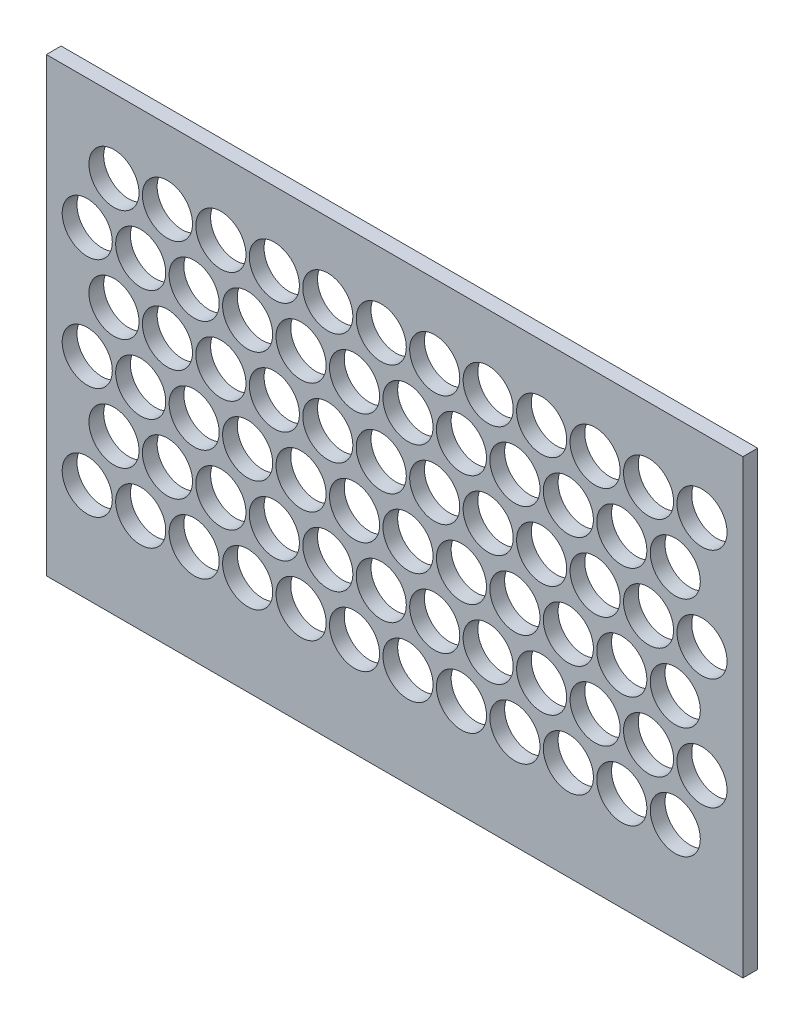
from build123d import *

# Parameters (mm, degrees)
SKETCH1_W                  = 299.700000132
SKETCH1_H                  = 194.250000104
BOSS_EXTRUDE1_DEPTH        = 6.35
CUT_EXTRUDE1_DEPTH         = 182.719853184
SKETCH4_R                  = 10.775
CUT_EXTRUDE2_DEPTH         = 182.719853184
LPATTERN1_COUNT            = 12
LPATTERN1_PITCH            = 23
LPATTERN2_COPY_1_DEPTH     = 182.719853184
LPATTERN2_COPY_2_DEPTH     = 182.719853184
LPATTERN2_COPY_3_DEPTH     = 182.719853184
LPATTERN2_COPY_4_DEPTH     = 182.719853184
LPATTERN2_COPY_5_DEPTH     = 182.719853184
LPATTERN2_COPY_6_DEPTH     = 182.719853184
LPATTERN2_COPY_7_DEPTH     = 182.719853184
LPATTERN2_COPY_8_DEPTH     = 182.719853184
LPATTERN2_COPY_9_DEPTH     = 182.719853184
LPATTERN2_COPY_10_DEPTH    = 182.719853184
LPATTERN2_COPY_11_DEPTH    = 182.719853184
LPATTERN2_COPY_12_DEPTH    = 182.719853184
LPATTERN2_COPY_13_DEPTH    = 182.719853184
LPATTERN2_COPY_14_DEPTH    = 182.719853184
LPATTERN2_COPY_15_DEPTH    = 182.719853184
LPATTERN2_COPY_16_DEPTH    = 182.719853184
LPATTERN2_COPY_17_DEPTH    = 182.719853184
LPATTERN2_COPY_18_DEPTH    = 182.719853184
LPATTERN2_COPY_19_DEPTH    = 182.719853184
LPATTERN2_COPY_20_DEPTH    = 182.719853184
LPATTERN2_COPY_21_DEPTH    = 182.719853184
LPATTERN2_COPY_22_DEPTH    = 182.719853184
LPATTERN2_COPY_23_SKETCH_R = 10.775
LPATTERN2_COPY_23_DEPTH    = 182.719853184
LPATTERN2_COPY_24_SKETCH_R = 10.775
LPATTERN2_COPY_24_DEPTH    = 182.719853184
LPATTERN2_COPY_25_SKETCH_R = 10.775
LPATTERN2_COPY_25_DEPTH    = 182.719853184
LPATTERN2_COPY_26_SKETCH_R = 10.775
LPATTERN2_COPY_26_DEPTH    = 182.719853184
LPATTERN2_COPY_27_SKETCH_R = 10.775
LPATTERN2_COPY_27_DEPTH    = 182.719853184
LPATTERN2_COPY_28_SKETCH_R = 10.775
LPATTERN2_COPY_28_DEPTH    = 182.719853184
LPATTERN2_COPY_29_SKETCH_R = 10.775
LPATTERN2_COPY_29_DEPTH    = 182.719853184
LPATTERN2_COPY_30_SKETCH_R = 10.775
LPATTERN2_COPY_30_DEPTH    = 182.719853184
LPATTERN2_COPY_31_SKETCH_R = 10.775
LPATTERN2_COPY_31_DEPTH    = 182.719853184
LPATTERN2_COPY_32_SKETCH_R = 10.775
LPATTERN2_COPY_32_DEPTH    = 182.719853184
LPATTERN2_COPY_33_SKETCH_R = 10.775
LPATTERN2_COPY_33_DEPTH    = 182.719853184
LPATTERN2_COPY_34_SKETCH_R = 10.775
LPATTERN2_COPY_34_DEPTH    = 182.719853184
LPATTERN2_COPY_35_SKETCH_R = 10.775
LPATTERN2_COPY_35_DEPTH    = 182.719853184
LPATTERN2_COPY_36_SKETCH_R = 10.775
LPATTERN2_COPY_36_DEPTH    = 182.719853184
LPATTERN2_COPY_37_SKETCH_R = 10.775
LPATTERN2_COPY_37_DEPTH    = 182.719853184
LPATTERN2_COPY_38_SKETCH_R = 10.775
LPATTERN2_COPY_38_DEPTH    = 182.719853184
LPATTERN2_COPY_39_SKETCH_R = 10.775
LPATTERN2_COPY_39_DEPTH    = 182.719853184
LPATTERN2_COPY_40_SKETCH_R = 10.775
LPATTERN2_COPY_40_DEPTH    = 182.719853184
LPATTERN2_COPY_41_SKETCH_R = 10.775
LPATTERN2_COPY_41_DEPTH    = 182.719853184
LPATTERN2_COPY_42_SKETCH_R = 10.775
LPATTERN2_COPY_42_DEPTH    = 182.719853184
LPATTERN2_COPY_43_SKETCH_R = 10.775
LPATTERN2_COPY_43_DEPTH    = 182.719853184
LPATTERN2_COPY_44_SKETCH_R = 10.775
LPATTERN2_COPY_44_DEPTH    = 182.719853184
LPATTERN2_COPY_45_DEPTH    = 182.719853184
LPATTERN2_COPY_46_DEPTH    = 182.719853184
LPATTERN2_COPY_47_SKETCH_R = 10.775
LPATTERN2_COPY_47_DEPTH    = 182.719853184
LPATTERN2_COPY_48_SKETCH_R = 10.775
LPATTERN2_COPY_48_DEPTH    = 182.719853184


with BuildPart() as part:
    # Sketch1 → Boss-Extrude1 (new body)
    with BuildSketch(Plane.XY):
        with Locations((0, -5.475000052)):
            Rectangle(SKETCH1_W, SKETCH1_H)
    extrude(amount=BOSS_EXTRUDE1_DEPTH)

    # Sketch3 → Cut-Extrude1 (cut, through all)
    with BuildSketch(Plane.XY.offset(6.35)):
        with BuildLine():
            ThreePointArc((-121.475, -60), (-132.24999993, -49.225), (-143.025, -59.999999859))
            ThreePointArc((-143.025, -59.999999859), (-139.869075617, -67.619075517), (-132.25, -70.775))
            ThreePointArc((-132.25, -70.775), (-124.630924433, -67.619075567), (-121.475, -60))
        make_face()
    cut_extrude1 = extrude(amount=-CUT_EXTRUDE1_DEPTH, mode=Mode.SUBTRACT)

    # Sketch4 → Cut-Extrude2 (cut, through all)
    with BuildSketch(Plane.XY.offset(6.35)):
        with Locations((-120.75, -36)):
            Circle(SKETCH4_R)
    cut_extrude2 = extrude(amount=-CUT_EXTRUDE2_DEPTH, mode=Mode.SUBTRACT)

    # LPattern1: Cut-Extrude1, Cut-Extrude2 ×12
    with Locations(*[(i * LPATTERN1_PITCH, 0, 0) for i in range(1, LPATTERN1_COUNT)]):
        add(cut_extrude1, mode=Mode.SUBTRACT)
        add(cut_extrude2, mode=Mode.SUBTRACT)

    # LPattern2 copy 1 sketch → LPattern2 copy 1 (cut, through all)
    with BuildSketch(Plane(origin=(23, 48, 6.35), x_dir=(1, 0, 0), z_dir=(0, 0, 1))):
        with BuildLine():
            ThreePointArc((-121.475, -60), (-132.24999993, -49.225), (-143.025, -59.999999859))
            ThreePointArc((-143.025, -59.999999859), (-139.869075617, -67.619075517), (-132.25, -70.775))
            ThreePointArc((-132.25, -70.775), (-124.630924433, -67.619075567), (-121.475, -60))
        make_face()
    extrude(amount=-LPATTERN2_COPY_1_DEPTH, mode=Mode.SUBTRACT)

    # LPattern2 copy 2 sketch → LPattern2 copy 2 (cut, through all)
    with BuildSketch(Plane(origin=(23, 96, 6.35), x_dir=(1, 0, 0), z_dir=(0, 0, 1))):
        with BuildLine():
            ThreePointArc((-121.475, -60), (-132.24999993, -49.225), (-143.025, -59.999999859))
            ThreePointArc((-143.025, -59.999999859), (-139.869075617, -67.619075517), (-132.25, -70.775))
            ThreePointArc((-132.25, -70.775), (-124.630924433, -67.619075567), (-121.475, -60))
        make_face()
    extrude(amount=-LPATTERN2_COPY_2_DEPTH, mode=Mode.SUBTRACT)

    # LPattern2 copy 3 sketch → LPattern2 copy 3 (cut, through all)
    with BuildSketch(Plane(origin=(46, 48, 6.35), x_dir=(1, 0, 0), z_dir=(0, 0, 1))):
        with BuildLine():
            ThreePointArc((-121.475, -60), (-132.24999993, -49.225), (-143.025, -59.999999859))
            ThreePointArc((-143.025, -59.999999859), (-139.869075617, -67.619075517), (-132.25, -70.775))
            ThreePointArc((-132.25, -70.775), (-124.630924433, -67.619075567), (-121.475, -60))
        make_face()
    extrude(amount=-LPATTERN2_COPY_3_DEPTH, mode=Mode.SUBTRACT)

    # LPattern2 copy 4 sketch → LPattern2 copy 4 (cut, through all)
    with BuildSketch(Plane(origin=(46, 96, 6.35), x_dir=(1, 0, 0), z_dir=(0, 0, 1))):
        with BuildLine():
            ThreePointArc((-121.475, -60), (-132.24999993, -49.225), (-143.025, -59.999999859))
            ThreePointArc((-143.025, -59.999999859), (-139.869075617, -67.619075517), (-132.25, -70.775))
            ThreePointArc((-132.25, -70.775), (-124.630924433, -67.619075567), (-121.475, -60))
        make_face()
    extrude(amount=-LPATTERN2_COPY_4_DEPTH, mode=Mode.SUBTRACT)

    # LPattern2 copy 5 sketch → LPattern2 copy 5 (cut, through all)
    with BuildSketch(Plane(origin=(69, 48, 6.35), x_dir=(1, 0, 0), z_dir=(0, 0, 1))):
        with BuildLine():
            ThreePointArc((-121.475, -60), (-132.24999993, -49.225), (-143.025, -59.999999859))
            ThreePointArc((-143.025, -59.999999859), (-139.869075617, -67.619075517), (-132.25, -70.775))
            ThreePointArc((-132.25, -70.775), (-124.630924433, -67.619075567), (-121.475, -60))
        make_face()
    extrude(amount=-LPATTERN2_COPY_5_DEPTH, mode=Mode.SUBTRACT)

    # LPattern2 copy 6 sketch → LPattern2 copy 6 (cut, through all)
    with BuildSketch(Plane(origin=(69, 96, 6.35), x_dir=(1, 0, 0), z_dir=(0, 0, 1))):
        with BuildLine():
            ThreePointArc((-121.475, -60), (-132.24999993, -49.225), (-143.025, -59.999999859))
            ThreePointArc((-143.025, -59.999999859), (-139.869075617, -67.619075517), (-132.25, -70.775))
            ThreePointArc((-132.25, -70.775), (-124.630924433, -67.619075567), (-121.475, -60))
        make_face()
    extrude(amount=-LPATTERN2_COPY_6_DEPTH, mode=Mode.SUBTRACT)

    # LPattern2 copy 7 sketch → LPattern2 copy 7 (cut, through all)
    with BuildSketch(Plane(origin=(92, 48, 6.35), x_dir=(1, 0, 0), z_dir=(0, 0, 1))):
        with BuildLine():
            ThreePointArc((-121.475, -60), (-132.24999993, -49.225), (-143.025, -59.999999859))
            ThreePointArc((-143.025, -59.999999859), (-139.869075617, -67.619075517), (-132.25, -70.775))
            ThreePointArc((-132.25, -70.775), (-124.630924433, -67.619075567), (-121.475, -60))
        make_face()
    extrude(amount=-LPATTERN2_COPY_7_DEPTH, mode=Mode.SUBTRACT)

    # LPattern2 copy 8 sketch → LPattern2 copy 8 (cut, through all)
    with BuildSketch(Plane(origin=(92, 96, 6.35), x_dir=(1, 0, 0), z_dir=(0, 0, 1))):
        with BuildLine():
            ThreePointArc((-121.475, -60), (-132.24999993, -49.225), (-143.025, -59.999999859))
            ThreePointArc((-143.025, -59.999999859), (-139.869075617, -67.619075517), (-132.25, -70.775))
            ThreePointArc((-132.25, -70.775), (-124.630924433, -67.619075567), (-121.475, -60))
        make_face()
    extrude(amount=-LPATTERN2_COPY_8_DEPTH, mode=Mode.SUBTRACT)

    # LPattern2 copy 9 sketch → LPattern2 copy 9 (cut, through all)
    with BuildSketch(Plane(origin=(115, 48, 6.35), x_dir=(1, 0, 0), z_dir=(0, 0, 1))):
        with BuildLine():
            ThreePointArc((-121.475, -60), (-132.24999993, -49.225), (-143.025, -59.999999859))
            ThreePointArc((-143.025, -59.999999859), (-139.869075617, -67.619075517), (-132.25, -70.775))
            ThreePointArc((-132.25, -70.775), (-124.630924433, -67.619075567), (-121.475, -60))
        make_face()
    extrude(amount=-LPATTERN2_COPY_9_DEPTH, mode=Mode.SUBTRACT)

    # LPattern2 copy 10 sketch → LPattern2 copy 10 (cut, through all)
    with BuildSketch(Plane(origin=(115, 96, 6.35), x_dir=(1, 0, 0), z_dir=(0, 0, 1))):
        with BuildLine():
            ThreePointArc((-121.475, -60), (-132.24999993, -49.225), (-143.025, -59.999999859))
            ThreePointArc((-143.025, -59.999999859), (-139.869075617, -67.619075517), (-132.25, -70.775))
            ThreePointArc((-132.25, -70.775), (-124.630924433, -67.619075567), (-121.475, -60))
        make_face()
    extrude(amount=-LPATTERN2_COPY_10_DEPTH, mode=Mode.SUBTRACT)

    # LPattern2 copy 11 sketch → LPattern2 copy 11 (cut, through all)
    with BuildSketch(Plane(origin=(138, 48, 6.35), x_dir=(1, 0, 0), z_dir=(0, 0, 1))):
        with BuildLine():
            ThreePointArc((-121.475, -60), (-132.24999993, -49.225), (-143.025, -59.999999859))
            ThreePointArc((-143.025, -59.999999859), (-139.869075617, -67.619075517), (-132.25, -70.775))
            ThreePointArc((-132.25, -70.775), (-124.630924433, -67.619075567), (-121.475, -60))
        make_face()
    extrude(amount=-LPATTERN2_COPY_11_DEPTH, mode=Mode.SUBTRACT)

    # LPattern2 copy 12 sketch → LPattern2 copy 12 (cut, through all)
    with BuildSketch(Plane(origin=(138, 96, 6.35), x_dir=(1, 0, 0), z_dir=(0, 0, 1))):
        with BuildLine():
            ThreePointArc((-121.475, -60), (-132.24999993, -49.225), (-143.025, -59.999999859))
            ThreePointArc((-143.025, -59.999999859), (-139.869075617, -67.619075517), (-132.25, -70.775))
            ThreePointArc((-132.25, -70.775), (-124.630924433, -67.619075567), (-121.475, -60))
        make_face()
    extrude(amount=-LPATTERN2_COPY_12_DEPTH, mode=Mode.SUBTRACT)

    # LPattern2 copy 13 sketch → LPattern2 copy 13 (cut, through all)
    with BuildSketch(Plane(origin=(161, 48, 6.35), x_dir=(1, 0, 0), z_dir=(0, 0, 1))):
        with BuildLine():
            ThreePointArc((-121.475, -60), (-132.24999993, -49.225), (-143.025, -59.999999859))
            ThreePointArc((-143.025, -59.999999859), (-139.869075617, -67.619075517), (-132.25, -70.775))
            ThreePointArc((-132.25, -70.775), (-124.630924433, -67.619075567), (-121.475, -60))
        make_face()
    extrude(amount=-LPATTERN2_COPY_13_DEPTH, mode=Mode.SUBTRACT)

    # LPattern2 copy 14 sketch → LPattern2 copy 14 (cut, through all)
    with BuildSketch(Plane(origin=(161, 96, 6.35), x_dir=(1, 0, 0), z_dir=(0, 0, 1))):
        with BuildLine():
            ThreePointArc((-121.475, -60), (-132.24999993, -49.225), (-143.025, -59.999999859))
            ThreePointArc((-143.025, -59.999999859), (-139.869075617, -67.619075517), (-132.25, -70.775))
            ThreePointArc((-132.25, -70.775), (-124.630924433, -67.619075567), (-121.475, -60))
        make_face()
    extrude(amount=-LPATTERN2_COPY_14_DEPTH, mode=Mode.SUBTRACT)

    # LPattern2 copy 15 sketch → LPattern2 copy 15 (cut, through all)
    with BuildSketch(Plane(origin=(184, 48, 6.35), x_dir=(1, 0, 0), z_dir=(0, 0, 1))):
        with BuildLine():
            ThreePointArc((-121.475, -60), (-132.24999993, -49.225), (-143.025, -59.999999859))
            ThreePointArc((-143.025, -59.999999859), (-139.869075617, -67.619075517), (-132.25, -70.775))
            ThreePointArc((-132.25, -70.775), (-124.630924433, -67.619075567), (-121.475, -60))
        make_face()
    extrude(amount=-LPATTERN2_COPY_15_DEPTH, mode=Mode.SUBTRACT)

    # LPattern2 copy 16 sketch → LPattern2 copy 16 (cut, through all)
    with BuildSketch(Plane(origin=(184, 96, 6.35), x_dir=(1, 0, 0), z_dir=(0, 0, 1))):
        with BuildLine():
            ThreePointArc((-121.475, -60), (-132.24999993, -49.225), (-143.025, -59.999999859))
            ThreePointArc((-143.025, -59.999999859), (-139.869075617, -67.619075517), (-132.25, -70.775))
            ThreePointArc((-132.25, -70.775), (-124.630924433, -67.619075567), (-121.475, -60))
        make_face()
    extrude(amount=-LPATTERN2_COPY_16_DEPTH, mode=Mode.SUBTRACT)

    # LPattern2 copy 17 sketch → LPattern2 copy 17 (cut, through all)
    with BuildSketch(Plane(origin=(207, 48, 6.35), x_dir=(1, 0, 0), z_dir=(0, 0, 1))):
        with BuildLine():
            ThreePointArc((-121.475, -60), (-132.24999993, -49.225), (-143.025, -59.999999859))
            ThreePointArc((-143.025, -59.999999859), (-139.869075617, -67.619075517), (-132.25, -70.775))
            ThreePointArc((-132.25, -70.775), (-124.630924433, -67.619075567), (-121.475, -60))
        make_face()
    extrude(amount=-LPATTERN2_COPY_17_DEPTH, mode=Mode.SUBTRACT)

    # LPattern2 copy 18 sketch → LPattern2 copy 18 (cut, through all)
    with BuildSketch(Plane(origin=(207, 96, 6.35), x_dir=(1, 0, 0), z_dir=(0, 0, 1))):
        with BuildLine():
            ThreePointArc((-121.475, -60), (-132.24999993, -49.225), (-143.025, -59.999999859))
            ThreePointArc((-143.025, -59.999999859), (-139.869075617, -67.619075517), (-132.25, -70.775))
            ThreePointArc((-132.25, -70.775), (-124.630924433, -67.619075567), (-121.475, -60))
        make_face()
    extrude(amount=-LPATTERN2_COPY_18_DEPTH, mode=Mode.SUBTRACT)

    # LPattern2 copy 19 sketch → LPattern2 copy 19 (cut, through all)
    with BuildSketch(Plane(origin=(230, 48, 6.35), x_dir=(1, 0, 0), z_dir=(0, 0, 1))):
        with BuildLine():
            ThreePointArc((-121.475, -60), (-132.24999993, -49.225), (-143.025, -59.999999859))
            ThreePointArc((-143.025, -59.999999859), (-139.869075617, -67.619075517), (-132.25, -70.775))
            ThreePointArc((-132.25, -70.775), (-124.630924433, -67.619075567), (-121.475, -60))
        make_face()
    extrude(amount=-LPATTERN2_COPY_19_DEPTH, mode=Mode.SUBTRACT)

    # LPattern2 copy 20 sketch → LPattern2 copy 20 (cut, through all)
    with BuildSketch(Plane(origin=(230, 96, 6.35), x_dir=(1, 0, 0), z_dir=(0, 0, 1))):
        with BuildLine():
            ThreePointArc((-121.475, -60), (-132.24999993, -49.225), (-143.025, -59.999999859))
            ThreePointArc((-143.025, -59.999999859), (-139.869075617, -67.619075517), (-132.25, -70.775))
            ThreePointArc((-132.25, -70.775), (-124.630924433, -67.619075567), (-121.475, -60))
        make_face()
    extrude(amount=-LPATTERN2_COPY_20_DEPTH, mode=Mode.SUBTRACT)

    # LPattern2 copy 21 sketch → LPattern2 copy 21 (cut, through all)
    with BuildSketch(Plane(origin=(253, 48, 6.35), x_dir=(1, 0, 0), z_dir=(0, 0, 1))):
        with BuildLine():
            ThreePointArc((-121.475, -60), (-132.24999993, -49.225), (-143.025, -59.999999859))
            ThreePointArc((-143.025, -59.999999859), (-139.869075617, -67.619075517), (-132.25, -70.775))
            ThreePointArc((-132.25, -70.775), (-124.630924433, -67.619075567), (-121.475, -60))
        make_face()
    extrude(amount=-LPATTERN2_COPY_21_DEPTH, mode=Mode.SUBTRACT)

    # LPattern2 copy 22 sketch → LPattern2 copy 22 (cut, through all)
    with BuildSketch(Plane(origin=(253, 96, 6.35), x_dir=(1, 0, 0), z_dir=(0, 0, 1))):
        with BuildLine():
            ThreePointArc((-121.475, -60), (-132.24999993, -49.225), (-143.025, -59.999999859))
            ThreePointArc((-143.025, -59.999999859), (-139.869075617, -67.619075517), (-132.25, -70.775))
            ThreePointArc((-132.25, -70.775), (-124.630924433, -67.619075567), (-121.475, -60))
        make_face()
    extrude(amount=-LPATTERN2_COPY_22_DEPTH, mode=Mode.SUBTRACT)

    # LPattern2 copy 23 sketch → LPattern2 copy 23 (cut, through all)
    with BuildSketch(Plane(origin=(23, 48, 6.35), x_dir=(1, 0, 0), z_dir=(0, 0, 1))):
        with Locations((-120.75, -36)):
            Circle(LPATTERN2_COPY_23_SKETCH_R)
    extrude(amount=-LPATTERN2_COPY_23_DEPTH, mode=Mode.SUBTRACT)

    # LPattern2 copy 24 sketch → LPattern2 copy 24 (cut, through all)
    with BuildSketch(Plane(origin=(23, 96, 6.35), x_dir=(1, 0, 0), z_dir=(0, 0, 1))):
        with Locations((-120.75, -36)):
            Circle(LPATTERN2_COPY_24_SKETCH_R)
    extrude(amount=-LPATTERN2_COPY_24_DEPTH, mode=Mode.SUBTRACT)

    # LPattern2 copy 25 sketch → LPattern2 copy 25 (cut, through all)
    with BuildSketch(Plane(origin=(46, 48, 6.35), x_dir=(1, 0, 0), z_dir=(0, 0, 1))):
        with Locations((-120.75, -36)):
            Circle(LPATTERN2_COPY_25_SKETCH_R)
    extrude(amount=-LPATTERN2_COPY_25_DEPTH, mode=Mode.SUBTRACT)

    # LPattern2 copy 26 sketch → LPattern2 copy 26 (cut, through all)
    with BuildSketch(Plane(origin=(46, 96, 6.35), x_dir=(1, 0, 0), z_dir=(0, 0, 1))):
        with Locations((-120.75, -36)):
            Circle(LPATTERN2_COPY_26_SKETCH_R)
    extrude(amount=-LPATTERN2_COPY_26_DEPTH, mode=Mode.SUBTRACT)

    # LPattern2 copy 27 sketch → LPattern2 copy 27 (cut, through all)
    with BuildSketch(Plane(origin=(69, 48, 6.35), x_dir=(1, 0, 0), z_dir=(0, 0, 1))):
        with Locations((-120.75, -36)):
            Circle(LPATTERN2_COPY_27_SKETCH_R)
    extrude(amount=-LPATTERN2_COPY_27_DEPTH, mode=Mode.SUBTRACT)

    # LPattern2 copy 28 sketch → LPattern2 copy 28 (cut, through all)
    with BuildSketch(Plane(origin=(69, 96, 6.35), x_dir=(1, 0, 0), z_dir=(0, 0, 1))):
        with Locations((-120.75, -36)):
            Circle(LPATTERN2_COPY_28_SKETCH_R)
    extrude(amount=-LPATTERN2_COPY_28_DEPTH, mode=Mode.SUBTRACT)

    # LPattern2 copy 29 sketch → LPattern2 copy 29 (cut, through all)
    with BuildSketch(Plane(origin=(92, 48, 6.35), x_dir=(1, 0, 0), z_dir=(0, 0, 1))):
        with Locations((-120.75, -36)):
            Circle(LPATTERN2_COPY_29_SKETCH_R)
    extrude(amount=-LPATTERN2_COPY_29_DEPTH, mode=Mode.SUBTRACT)

    # LPattern2 copy 30 sketch → LPattern2 copy 30 (cut, through all)
    with BuildSketch(Plane(origin=(92, 96, 6.35), x_dir=(1, 0, 0), z_dir=(0, 0, 1))):
        with Locations((-120.75, -36)):
            Circle(LPATTERN2_COPY_30_SKETCH_R)
    extrude(amount=-LPATTERN2_COPY_30_DEPTH, mode=Mode.SUBTRACT)

    # LPattern2 copy 31 sketch → LPattern2 copy 31 (cut, through all)
    with BuildSketch(Plane(origin=(115, 48, 6.35), x_dir=(1, 0, 0), z_dir=(0, 0, 1))):
        with Locations((-120.75, -36)):
            Circle(LPATTERN2_COPY_31_SKETCH_R)
    extrude(amount=-LPATTERN2_COPY_31_DEPTH, mode=Mode.SUBTRACT)

    # LPattern2 copy 32 sketch → LPattern2 copy 32 (cut, through all)
    with BuildSketch(Plane(origin=(115, 96, 6.35), x_dir=(1, 0, 0), z_dir=(0, 0, 1))):
        with Locations((-120.75, -36)):
            Circle(LPATTERN2_COPY_32_SKETCH_R)
    extrude(amount=-LPATTERN2_COPY_32_DEPTH, mode=Mode.SUBTRACT)

    # LPattern2 copy 33 sketch → LPattern2 copy 33 (cut, through all)
    with BuildSketch(Plane(origin=(138, 48, 6.35), x_dir=(1, 0, 0), z_dir=(0, 0, 1))):
        with Locations((-120.75, -36)):
            Circle(LPATTERN2_COPY_33_SKETCH_R)
    extrude(amount=-LPATTERN2_COPY_33_DEPTH, mode=Mode.SUBTRACT)

    # LPattern2 copy 34 sketch → LPattern2 copy 34 (cut, through all)
    with BuildSketch(Plane(origin=(138, 96, 6.35), x_dir=(1, 0, 0), z_dir=(0, 0, 1))):
        with Locations((-120.75, -36)):
            Circle(LPATTERN2_COPY_34_SKETCH_R)
    extrude(amount=-LPATTERN2_COPY_34_DEPTH, mode=Mode.SUBTRACT)

    # LPattern2 copy 35 sketch → LPattern2 copy 35 (cut, through all)
    with BuildSketch(Plane(origin=(161, 48, 6.35), x_dir=(1, 0, 0), z_dir=(0, 0, 1))):
        with Locations((-120.75, -36)):
            Circle(LPATTERN2_COPY_35_SKETCH_R)
    extrude(amount=-LPATTERN2_COPY_35_DEPTH, mode=Mode.SUBTRACT)

    # LPattern2 copy 36 sketch → LPattern2 copy 36 (cut, through all)
    with BuildSketch(Plane(origin=(161, 96, 6.35), x_dir=(1, 0, 0), z_dir=(0, 0, 1))):
        with Locations((-120.75, -36)):
            Circle(LPATTERN2_COPY_36_SKETCH_R)
    extrude(amount=-LPATTERN2_COPY_36_DEPTH, mode=Mode.SUBTRACT)

    # LPattern2 copy 37 sketch → LPattern2 copy 37 (cut, through all)
    with BuildSketch(Plane(origin=(184, 48, 6.35), x_dir=(1, 0, 0), z_dir=(0, 0, 1))):
        with Locations((-120.75, -36)):
            Circle(LPATTERN2_COPY_37_SKETCH_R)
    extrude(amount=-LPATTERN2_COPY_37_DEPTH, mode=Mode.SUBTRACT)

    # LPattern2 copy 38 sketch → LPattern2 copy 38 (cut, through all)
    with BuildSketch(Plane(origin=(184, 96, 6.35), x_dir=(1, 0, 0), z_dir=(0, 0, 1))):
        with Locations((-120.75, -36)):
            Circle(LPATTERN2_COPY_38_SKETCH_R)
    extrude(amount=-LPATTERN2_COPY_38_DEPTH, mode=Mode.SUBTRACT)

    # LPattern2 copy 39 sketch → LPattern2 copy 39 (cut, through all)
    with BuildSketch(Plane(origin=(207, 48, 6.35), x_dir=(1, 0, 0), z_dir=(0, 0, 1))):
        with Locations((-120.75, -36)):
            Circle(LPATTERN2_COPY_39_SKETCH_R)
    extrude(amount=-LPATTERN2_COPY_39_DEPTH, mode=Mode.SUBTRACT)

    # LPattern2 copy 40 sketch → LPattern2 copy 40 (cut, through all)
    with BuildSketch(Plane(origin=(207, 96, 6.35), x_dir=(1, 0, 0), z_dir=(0, 0, 1))):
        with Locations((-120.75, -36)):
            Circle(LPATTERN2_COPY_40_SKETCH_R)
    extrude(amount=-LPATTERN2_COPY_40_DEPTH, mode=Mode.SUBTRACT)

    # LPattern2 copy 41 sketch → LPattern2 copy 41 (cut, through all)
    with BuildSketch(Plane(origin=(230, 48, 6.35), x_dir=(1, 0, 0), z_dir=(0, 0, 1))):
        with Locations((-120.75, -36)):
            Circle(LPATTERN2_COPY_41_SKETCH_R)
    extrude(amount=-LPATTERN2_COPY_41_DEPTH, mode=Mode.SUBTRACT)

    # LPattern2 copy 42 sketch → LPattern2 copy 42 (cut, through all)
    with BuildSketch(Plane(origin=(230, 96, 6.35), x_dir=(1, 0, 0), z_dir=(0, 0, 1))):
        with Locations((-120.75, -36)):
            Circle(LPATTERN2_COPY_42_SKETCH_R)
    extrude(amount=-LPATTERN2_COPY_42_DEPTH, mode=Mode.SUBTRACT)

    # LPattern2 copy 43 sketch → LPattern2 copy 43 (cut, through all)
    with BuildSketch(Plane(origin=(253, 48, 6.35), x_dir=(1, 0, 0), z_dir=(0, 0, 1))):
        with Locations((-120.75, -36)):
            Circle(LPATTERN2_COPY_43_SKETCH_R)
    extrude(amount=-LPATTERN2_COPY_43_DEPTH, mode=Mode.SUBTRACT)

    # LPattern2 copy 44 sketch → LPattern2 copy 44 (cut, through all)
    with BuildSketch(Plane(origin=(253, 96, 6.35), x_dir=(1, 0, 0), z_dir=(0, 0, 1))):
        with Locations((-120.75, -36)):
            Circle(LPATTERN2_COPY_44_SKETCH_R)
    extrude(amount=-LPATTERN2_COPY_44_DEPTH, mode=Mode.SUBTRACT)

    # LPattern2 copy 45 sketch → LPattern2 copy 45 (cut, through all)
    with BuildSketch(Plane(origin=(0, 48, 6.35), x_dir=(1, 0, 0), z_dir=(0, 0, 1))):
        with BuildLine():
            ThreePointArc((-121.475, -60), (-132.24999993, -49.225), (-143.025, -59.999999859))
            ThreePointArc((-143.025, -59.999999859), (-139.869075617, -67.619075517), (-132.25, -70.775))
            ThreePointArc((-132.25, -70.775), (-124.630924433, -67.619075567), (-121.475, -60))
        make_face()
    extrude(amount=-LPATTERN2_COPY_45_DEPTH, mode=Mode.SUBTRACT)

    # LPattern2 copy 46 sketch → LPattern2 copy 46 (cut, through all)
    with BuildSketch(Plane(origin=(0, 96, 6.35), x_dir=(1, 0, 0), z_dir=(0, 0, 1))):
        with BuildLine():
            ThreePointArc((-121.475, -60), (-132.24999993, -49.225), (-143.025, -59.999999859))
            ThreePointArc((-143.025, -59.999999859), (-139.869075617, -67.619075517), (-132.25, -70.775))
            ThreePointArc((-132.25, -70.775), (-124.630924433, -67.619075567), (-121.475, -60))
        make_face()
    extrude(amount=-LPATTERN2_COPY_46_DEPTH, mode=Mode.SUBTRACT)

    # LPattern2 copy 47 sketch → LPattern2 copy 47 (cut, through all)
    with BuildSketch(Plane(origin=(0, 48, 6.35), x_dir=(1, 0, 0), z_dir=(0, 0, 1))):
        with Locations((-120.75, -36)):
            Circle(LPATTERN2_COPY_47_SKETCH_R)
    extrude(amount=-LPATTERN2_COPY_47_DEPTH, mode=Mode.SUBTRACT)

    # LPattern2 copy 48 sketch → LPattern2 copy 48 (cut, through all)
    with BuildSketch(Plane(origin=(0, 96, 6.35), x_dir=(1, 0, 0), z_dir=(0, 0, 1))):
        with Locations((-120.75, -36)):
            Circle(LPATTERN2_COPY_48_SKETCH_R)
    extrude(amount=-LPATTERN2_COPY_48_DEPTH, mode=Mode.SUBTRACT)


solid = part.part
